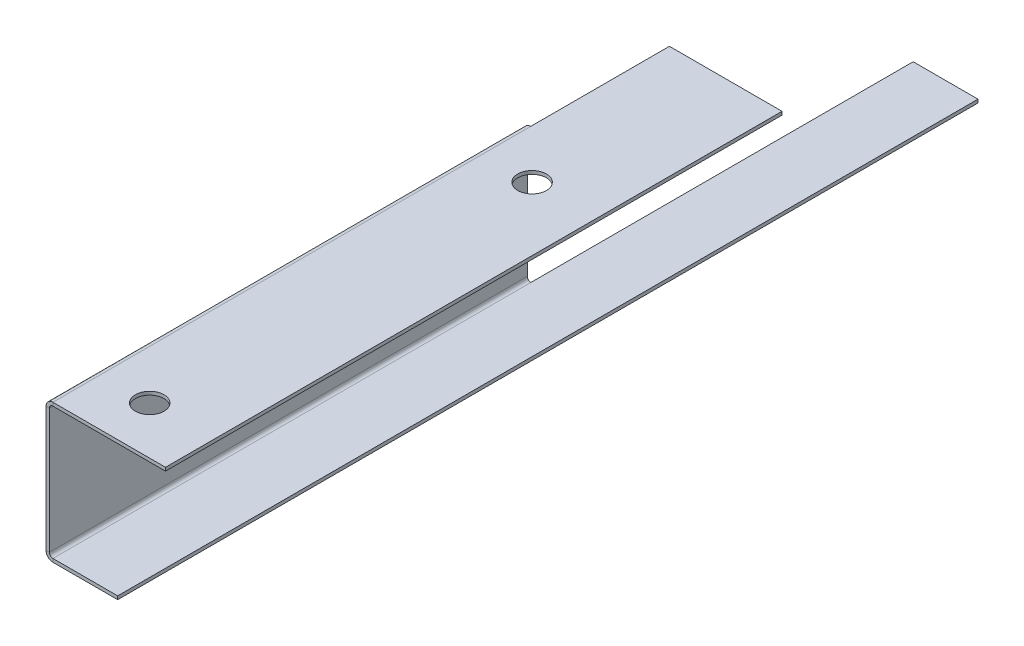
from build123d import *

# Parameters (mm, degrees)
SM_BASE_FLANGE_1_DEPTH = 100
SKETCH_6_W             = 23.5634
SKETCH_6_H             = 29
EXTRUDE_1_DEPTH        = 0.7
SKETCH_8_W             = 13.5634
SKETCH_8_H             = 80
EXTRUDE_3_DEPTH        = 0.7
SKETCH_9_R             = 3
CUT_EXTRUDE_1_DEPTH    = 0.7


# Sheet-metal steps are written as plain solids
with BuildPart() as part:
    # Sketch 1 → 基体-法兰1 (new body)
    with BuildSketch(Plane.XY):
        with BuildLine():
            Line((25, 29), (1.4366, 29))
            ThreePointArc((1.4366, 29), (0.420770398, 28.579229602), (0, 27.5634))
            Line((0, 27.5634), (0, 1.4366))
            ThreePointArc((0, 1.4366), (0.420770398, 0.420770398), (1.4366, 0))
            Line((1.4366, 0), (15, 0))
            Line((15, 0), (15, 0.7))
            Line((15, 0.7), (1.4366, 0.7))
            ThreePointArc((1.4366, 0.7), (0.915745145, 0.915745145), (0.7, 1.4366))
            Line((0.7, 1.4366), (0.7, 27.5634))
            ThreePointArc((0.7, 27.5634), (0.915745145, 28.084254855), (1.4366, 28.3))
            Line((1.4366, 28.3), (25, 28.3))
            Line((25, 28.3), (25, 29))
        make_face()
    extrude(amount=SM_BASE_FLANGE_1_DEPTH)

    # 草图6 → 凸台-拉伸1 (add)
    with BuildSketch(Plane(origin=(0, 29, 0), x_dir=(1, 0, 0), z_dir=(0, 1, 0))):
        with Locations((13.2183, 14.5)):
            Rectangle(SKETCH_6_W, SKETCH_6_H)
    extrude(amount=-EXTRUDE_1_DEPTH)

    # 草图8 → 凸台-拉伸3 (add)
    with BuildSketch(Plane.XZ):
        with Locations((8.2183, -40)):
            Rectangle(SKETCH_8_W, SKETCH_8_H)
    extrude(amount=-EXTRUDE_3_DEPTH)

    # 草图9 → 切除-拉伸1 (cut)
    with BuildSketch(Plane(origin=(0, 29, 0), x_dir=(1, 0, 0), z_dir=(0, 1, 0))):
        with Locations(Location((11.7, -90, 0), (0, 0, 270))):
            Circle(SKETCH_9_R)
        with Locations(Location((11.7, -10, 0), (0, 0, 270))):
            Circle(SKETCH_9_R)
    extrude(amount=-CUT_EXTRUDE_1_DEPTH, mode=Mode.SUBTRACT)


solid = part.part
